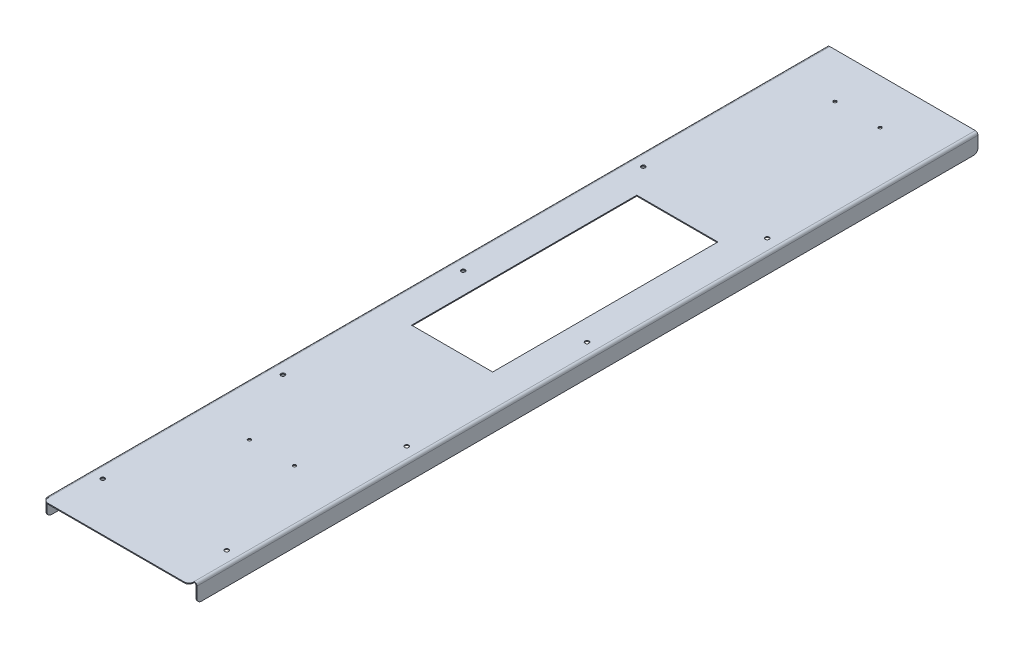
from build123d import *

# Parameters (mm, degrees)
SKETCH_1_W                  = 323
SKETCH_1_H                  = 1746
SKETCH_1_R                  = 4.5
SKETCH_1_R_2                = 3.5
SKETCH_1_W_2                = 180
SKETCH_1_H_2                = 500
SM_BASE_FLANGE_1_DEPTH      = 2
SM_EDGE_FLANGE_1_DEPTH      = 1734
SM_EDGE_FLANGE_1_BEND_DEPTH = 1734
FILLET_1_R                  = 10
FILLET_2_R                  = 10


# Sheet-metal steps are written as plain solids
with BuildPart() as part:
    # Sketch 1 → Базовая кромка1 (new body)
    with BuildSketch(Plane(origin=(0, 0, 0), x_dir=(1, 0, 0), z_dir=(0, 1, 0))):
        Rectangle(SKETCH_1_W, SKETCH_1_H)
        with Locations(Location((-137.5, -765, 0), (0, 0, 270))):
            Circle(SKETCH_1_R, mode=Mode.SUBTRACT)
        with Locations(Location((137.5, -765, 0), (0, 0, 270))):
            Circle(SKETCH_1_R, mode=Mode.SUBTRACT)
        with Locations(Location((-137.5, -365, 0), (0, 0, 270))):
            Circle(SKETCH_1_R, mode=Mode.SUBTRACT)
        with Locations(Location((137.5, -365, 0), (0, 0, 270))):
            Circle(SKETCH_1_R, mode=Mode.SUBTRACT)
        with Locations(Location((-137.5, 35, 0), (0, 0, 270))):
            Circle(SKETCH_1_R, mode=Mode.SUBTRACT)
        with Locations(Location((137.5, 35, 0), (0, 0, 270))):
            Circle(SKETCH_1_R, mode=Mode.SUBTRACT)
        with Locations(Location((-137.5, 435, 0), (0, 0, 270))):
            Circle(SKETCH_1_R, mode=Mode.SUBTRACT)
        with Locations(Location((137.5, 435, 0), (0, 0, 270))):
            Circle(SKETCH_1_R, mode=Mode.SUBTRACT)
        with Locations(Location((-50, -527, 0), (0, 0, 270))):
            Circle(SKETCH_1_R_2, mode=Mode.SUBTRACT)
        with Locations(Location((50, -527, 0), (0, 0, 270))):
            Circle(SKETCH_1_R_2, mode=Mode.SUBTRACT)
        with Locations(Location((-50, 773, 0), (0, 0, 270))):
            Circle(SKETCH_1_R_2, mode=Mode.SUBTRACT)
        with Locations(Location((50, 773, 0), (0, 0, 270))):
            Circle(SKETCH_1_R_2, mode=Mode.SUBTRACT)
        with Locations((0, 123)):
            Rectangle(SKETCH_1_W_2, SKETCH_1_H_2, mode=Mode.SUBTRACT)
    extrude(amount=-SM_BASE_FLANGE_1_DEPTH)

    # Ребро-кромка1 section (across the edge) → Ребро-кромка1 (add)
    with BuildSketch(Plane(origin=(165.5, -2, -873), x_dir=(-1, 0, 0), z_dir=(0, 0, 1))):
        with BuildLine():
            Line((-2, 4), (-2, 38))
            Line((-2, 38), (0, 38))
            Line((0, 38), (0, 4))
            ThreePointArc((0, 4), (1.171572875, 1.171572875), (4, 0))
            Line((4, 0), (4, -2))
            ThreePointArc((4, -2), (-0.242640687, -0.242640687), (-2, 4))
        make_face()
    extrude(amount=SM_EDGE_FLANGE_1_DEPTH)

    # Ребро-кромка1 section 2 (across the edge) → Ребро-кромка1 bend (add)
    with BuildSketch(Plane(origin=(-165.5, -2, 861), x_dir=(1, 0, 0), z_dir=(0, 0, -1))):
        with BuildLine():
            Line((-2, 4), (-2, 38))
            Line((-2, 38), (0, 38))
            Line((0, 38), (0, 4))
            ThreePointArc((0, 4), (1.171572875, 1.171572875), (4, 0))
            Line((4, 0), (4, -2))
            ThreePointArc((4, -2), (-0.242640687, -0.242640687), (-2, 4))
        make_face()
    extrude(amount=SM_EDGE_FLANGE_1_BEND_DEPTH)

    # Скругление1
    fillet_1_edges = [part.edges().sort_by_distance(p)[0] for p in [
        (-166.5, -40, 861),
        (-166.5, -40, -873),
        (166.5, -40, -873),
        (166.5, -40, 861),
    ]]
    fillet(fillet_1_edges, radius=FILLET_1_R)

    # Скругление2
    fillet_2_edges = [part.edges().sort_by_distance(p)[0] for p in [
        (161.5, -1, 873),
        (-161.5, -1, 873),
    ]]
    fillet(fillet_2_edges, radius=FILLET_2_R)


solid = part.part
